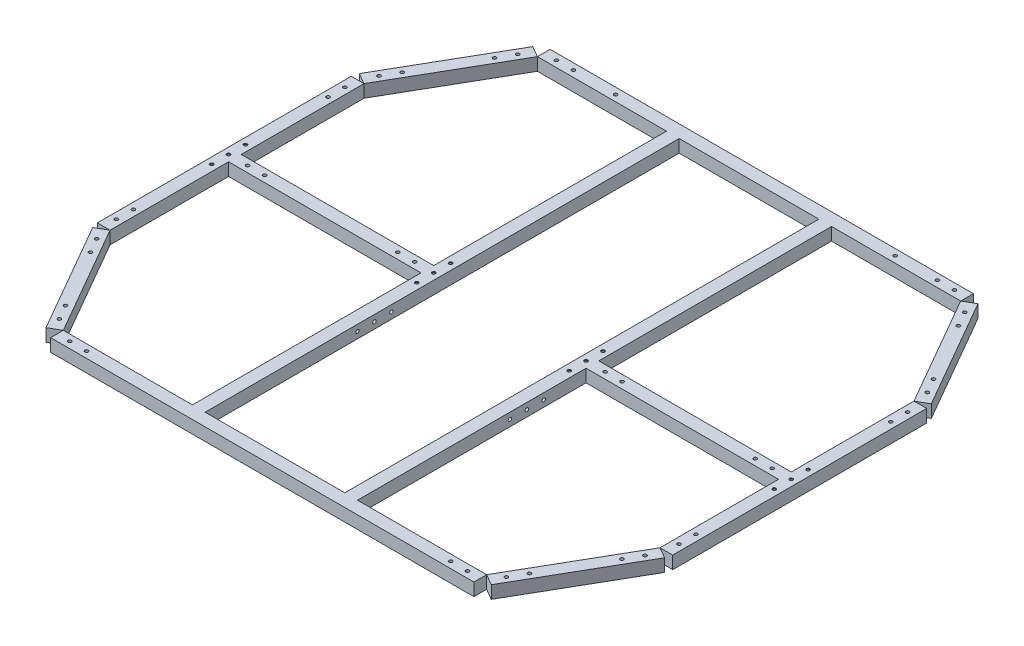
from build123d import *

# Parameters (mm, degrees)
SKETCH_1_R          = 2
EXTRUDE_1_DEPTH     = 15
SKETCH_1_W          = 165
SKETCH_1_H          = 560
EXTRUDE_1_2_DEPTH   = 15
SKETCH_1_W_2        = 15
SKETCH_1_H_2        = 300
EXTRUDE_1_3_DEPTH   = 15
EXTRUDE_1_4_DEPTH   = 15
EXTRUDE_1_5_DEPTH   = 15
EXTRUDE_1_6_DEPTH   = 15
EXTRUDE_1_7_DEPTH   = 15
SKETCH_2_R          = 2
CUT_EXTRUDE_1_DEPTH = 310
SKETCH_3_R          = 2
CUT_EXTRUDE_2_DEPTH = 333
SHELL_1_T           = -1
SHELL_2_T           = -1
SHELL_3_T           = -1
SHELL_4_T           = -1
MIRROR_START        = 1
MIRROR_1_OUTLINE_R  = 3
MIRROR_1_OUTLINE_W  = 13
MIRROR_1_OUTLINE_H  = 299
MIRROR_1_DEPTH      = 13
SKETCH_4_W          = 227.333147735
SKETCH_4_H          = 15
EXTRUDE_2_DEPTH     = 15
SKETCH_5_R          = 2
CUT_EXTRUDE_3_DEPTH = 15


# Read off the part's stored shape, not the designer's step: 镜向1
with BuildPart() as part:
    # 草图1 → 凸台-拉伸1 (new body)
    with BuildSketch(Plane(origin=(0, 0, 0), x_dir=(1, 0, 0), z_dir=(0, 1, 0))):
        Polygon((-263, 0.016685226), (-250, 7.5), (-324.833147735, 137.5), (-337.833147735, 130.016685226), align=None)
        with Locations(Location((-263.983314774, 16.758342613, 0), (0, 0, 270))):
            Circle(SKETCH_1_R, mode=Mode.SUBTRACT)
        with Locations(Location((-273.961067805, 34.091675947, 0), (0, 0, 270))):
            Circle(SKETCH_1_R, mode=Mode.SUBTRACT)
        with Locations(Location((-323.849832962, 120.758342613, 0), (0, 0, 270))):
            Circle(SKETCH_1_R, mode=Mode.SUBTRACT)
        with Locations(Location((-313.872079931, 103.42500928, 0), (0, 0, 270))):
            Circle(SKETCH_1_R, mode=Mode.SUBTRACT)
    extrude(amount=EXTRUDE_1_DEPTH)

    # 抽壳4
    shell_4_openings = [part.faces().sort_by_distance(p)[0] for p in [
        (-331.333147735, 7.5, -133.758342613),
    ]]
    offset(amount=SHELL_4_T, openings=shell_4_openings, kind=Kind.INTERSECTION)


with BuildPart() as body_2:
    # 草图1 → Extrude 1 2 (new body)
    with BuildSketch(Plane(origin=(0, 0, 0), x_dir=(1, 0, 0), z_dir=(0, 1, 0))):
        Polygon((250, 7.5), (97.5, 7.5), (97.5, 567.5), (250, 567.5), (250, 582.5), (-250, 582.5), (-250, 567.5), (-97.5, 567.5), (-97.5, 7.5), (-250, 7.5), (-250, -7.5), (250, -7.5), align=None)
        with Locations((0, 287.5)):
            Rectangle(SKETCH_1_W, SKETCH_1_H, mode=Mode.SUBTRACT)
        with Locations(Location((-235, 0, 0), (0, 0, 270))):
            Circle(SKETCH_1_R, mode=Mode.SUBTRACT)
        with Locations(Location((-215, 0, 0), (0, 0, 270))):
            Circle(SKETCH_1_R, mode=Mode.SUBTRACT)
        with Locations(Location((215, 0, 0), (0, 0, 270))):
            Circle(SKETCH_1_R, mode=Mode.SUBTRACT)
        with Locations(Location((235, 0, 0), (0, 0, 270))):
            Circle(SKETCH_1_R, mode=Mode.SUBTRACT)
        with Locations(Location((235, 575, 0), (0, 0, 270))):
            Circle(SKETCH_1_R, mode=Mode.SUBTRACT)
        with Locations(Location((-235, 575, 0), (0, 0, 270))):
            Circle(SKETCH_1_R, mode=Mode.SUBTRACT)
        with Locations(Location((-215, 575, 0), (0, 0, 270))):
            Circle(SKETCH_1_R, mode=Mode.SUBTRACT)
        with Locations(Location((215, 575, 0), (0, 0, 270))):
            Circle(SKETCH_1_R, mode=Mode.SUBTRACT)
    extrude(amount=EXTRUDE_1_2_DEPTH)

    # 草图2 → 切除-拉伸1 (cut)
    with BuildSketch(Plane(origin=(97.5, 0, 0), x_dir=(0, 0, -1), z_dir=(1, 0, 0))):
        with Locations(Location((227.5, 7.5, 0), (0, 0, 180))):
            Circle(SKETCH_2_R)
        with Locations(Location((207.5, 7.5, 0), (0, 0, 180))):
            Circle(SKETCH_2_R)
        with Locations(Location((187.5, 7.5, 0), (0, 0, 180))):
            Circle(SKETCH_2_R)
    extrude(amount=-CUT_EXTRUDE_1_DEPTH, mode=Mode.SUBTRACT)

    # 草图3 → 切除-拉伸2 (cut)
    with BuildSketch(Plane(origin=(0, 15, 0), x_dir=(1, 0, 0), z_dir=(0, 1, 0))):
        with Locations(Location((-165, 575, 0), (0, 0, 270))):
            Circle(SKETCH_3_R)
        with Locations(Location((165, 575, 0), (0, 0, 270))):
            Circle(SKETCH_3_R)
    extrude(amount=-CUT_EXTRUDE_2_DEPTH, mode=Mode.SUBTRACT)

    # 抽壳1
    shell_1_openings = [body_2.faces().sort_by_distance(p)[0] for p in [
        (-250, 7.5, -575),
    ]]
    offset(amount=SHELL_1_T, openings=shell_1_openings, kind=Kind.INTERSECTION)



with BuildPart() as body_3:
    # 草图1 → Extrude 1 3 (new body)
    with BuildSketch(Plane(origin=(0, 0, 0), x_dir=(1, 0, 0), z_dir=(0, 1, 0))):
        with Locations((-332.333147735, 287.5)):
            Rectangle(SKETCH_1_W_2, SKETCH_1_H_2)
        with Locations(Location((-332.333147735, 152.5, 0), (0, 0, 270))):
            Circle(SKETCH_1_R, mode=Mode.SUBTRACT)
        with Locations(Location((-332.333147735, 172.5, 0), (0, 0, 270))):
            Circle(SKETCH_1_R, mode=Mode.SUBTRACT)
        with Locations(Location((-332.333147735, 402.5, 0), (0, 0, 270))):
            Circle(SKETCH_1_R, mode=Mode.SUBTRACT)
        with Locations(Location((-332.333147735, 422.5, 0), (0, 0, 270))):
            Circle(SKETCH_1_R, mode=Mode.SUBTRACT)
    extrude(amount=EXTRUDE_1_3_DEPTH)

    # 抽壳3
    shell_3_openings = [body_3.faces().sort_by_distance(p)[0] for p in [
        (-332.333147735, 7.5, -437.5),
    ]]
    offset(amount=SHELL_3_T, openings=shell_3_openings, kind=Kind.INTERSECTION)


with BuildPart() as body_4:
    # 草图1 → Extrude 1 4 (new body)
    with BuildSketch(Plane(origin=(0, 0, 0), x_dir=(1, 0, 0), z_dir=(0, 1, 0))):
        Polygon((-337.833147735, 444.983314774), (-324.833147735, 437.5), (-250, 567.5), (-263, 574.983314774), align=None)
        with Locations(Location((-323.849832962, 454.241657387, 0), (0, 0, 270))):
            Circle(SKETCH_1_R, mode=Mode.SUBTRACT)
        with Locations(Location((-313.872079931, 471.57499072, 0), (0, 0, 270))):
            Circle(SKETCH_1_R, mode=Mode.SUBTRACT)
        with Locations(Location((-273.961067805, 540.908324053, 0), (0, 0, 270))):
            Circle(SKETCH_1_R, mode=Mode.SUBTRACT)
        with Locations(Location((-263.983314774, 558.241657387, 0), (0, 0, 270))):
            Circle(SKETCH_1_R, mode=Mode.SUBTRACT)
    extrude(amount=EXTRUDE_1_4_DEPTH)

    # 抽壳2
    shell_2_openings = [body_4.faces().sort_by_distance(p)[0] for p in [
        (-256.5, 7.5, -571.241657387),
    ]]
    offset(amount=SHELL_2_T, openings=shell_2_openings, kind=Kind.INTERSECTION)


with BuildPart() as body_5:
    # 草图1 → Extrude 1 5 (new body)
    with BuildSketch(Plane(origin=(0, 0, 0), x_dir=(1, 0, 0), z_dir=(0, 1, 0))):
        Polygon((324.833147735, 137.5), (250, 7.5), (263, 0.016685226), (337.833147735, 130.016685226), align=None)
        with Locations(Location((263.983314774, 16.758342613, 0), (0, 0, 270))):
            Circle(SKETCH_1_R, mode=Mode.SUBTRACT)
        with Locations(Location((273.961067805, 34.091675947, 0), (0, 0, 270))):
            Circle(SKETCH_1_R, mode=Mode.SUBTRACT)
        with Locations(Location((313.872079931, 103.42500928, 0), (0, 0, 270))):
            Circle(SKETCH_1_R, mode=Mode.SUBTRACT)
        with Locations(Location((323.849832962, 120.758342613, 0), (0, 0, 270))):
            Circle(SKETCH_1_R, mode=Mode.SUBTRACT)
    extrude(amount=EXTRUDE_1_5_DEPTH)


with BuildPart() as body_6:
    # 草图1 → Extrude 1 6 (new body)
    with BuildSketch(Plane(origin=(0, 0, 0), x_dir=(1, 0, 0), z_dir=(0, 1, 0))):
        with Locations((332.333147735, 287.5)):
            Rectangle(SKETCH_1_W_2, SKETCH_1_H_2)
        with Locations(Location((332.333147735, 152.5, 0), (0, 0, 270))):
            Circle(SKETCH_1_R, mode=Mode.SUBTRACT)
        with Locations(Location((332.333147735, 172.5, 0), (0, 0, 270))):
            Circle(SKETCH_1_R, mode=Mode.SUBTRACT)
        with Locations(Location((332.333147735, 402.5, 0), (0, 0, 270))):
            Circle(SKETCH_1_R, mode=Mode.SUBTRACT)
        with Locations(Location((332.333147735, 422.5, 0), (0, 0, 270))):
            Circle(SKETCH_1_R, mode=Mode.SUBTRACT)
    extrude(amount=EXTRUDE_1_6_DEPTH)


with BuildPart() as body_7:
    # 草图1 → Extrude 1 7 (new body)
    with BuildSketch(Plane(origin=(0, 0, 0), x_dir=(1, 0, 0), z_dir=(0, 1, 0))):
        Polygon((250, 567.5), (324.833147735, 437.5), (337.833147735, 444.983314774), (263, 574.983314774), align=None)
        with Locations(Location((313.872079931, 471.57499072, 0), (0, 0, 270))):
            Circle(SKETCH_1_R, mode=Mode.SUBTRACT)
        with Locations(Location((323.849832962, 454.241657387, 0), (0, 0, 270))):
            Circle(SKETCH_1_R, mode=Mode.SUBTRACT)
        with Locations(Location((273.961067805, 540.908324053, 0), (0, 0, 270))):
            Circle(SKETCH_1_R, mode=Mode.SUBTRACT)
        with Locations(Location((263.983314774, 558.241657387, 0), (0, 0, 270))):
            Circle(SKETCH_1_R, mode=Mode.SUBTRACT)
    extrude(amount=EXTRUDE_1_7_DEPTH)


with BuildPart() as mirror_1_tool:
    # 镜向1 outline → 镜向1 (new body)
    # profile 1 of 3: a face of its own
    with BuildSketch(Plane(origin=(0, 0, 0), x_dir=(1, 0, 0), z_dir=(0, 1, 0)).offset(MIRROR_START)):
        Polygon((262.133333333, 574.484427122), (250.866666667, 567.998887652), (325.200926751, 438.865554318), (336.467593417, 445.351093789), align=None)
        with Locations((263.983314774, 558.241657387)):
            Circle(MIRROR_1_OUTLINE_R, mode=Mode.SUBTRACT)
        with Locations((273.961067805, 540.908324053)):
            Circle(MIRROR_1_OUTLINE_R, mode=Mode.SUBTRACT)
        with Locations((313.872079931, 471.57499072)):
            Circle(MIRROR_1_OUTLINE_R, mode=Mode.SUBTRACT)
        with Locations((323.849832962, 454.241657387)):
            Circle(MIRROR_1_OUTLINE_R, mode=Mode.SUBTRACT)
    # profile 2 of 3: a face of its own
    with BuildSketch(Plane(origin=(0, 0, 0), x_dir=(1, 0, 0), z_dir=(0, 1, 0)).offset(MIRROR_START)):
        Polygon((262.632220985, 1.382239545), (336.966481069, 130.515572878), (325.699814402, 137.001112348), (251.365554318, 7.867779015), align=None)
        with Locations((263.983314774, 16.758342613)):
            Circle(MIRROR_1_OUTLINE_R, mode=Mode.SUBTRACT)
        with Locations((273.961067805, 34.091675947)):
            Circle(MIRROR_1_OUTLINE_R, mode=Mode.SUBTRACT)
        with Locations((313.872079931, 103.42500928)):
            Circle(MIRROR_1_OUTLINE_R, mode=Mode.SUBTRACT)
        with Locations((323.849832962, 120.758342613)):
            Circle(MIRROR_1_OUTLINE_R, mode=Mode.SUBTRACT)
    # profile 3 of 3: a face of its own
    with BuildSketch(Plane(origin=(0, 0, 0), x_dir=(1, 0, 0), z_dir=(0, 1, 0)).offset(MIRROR_START)):
        with Locations((332.333147735, 288)):
            Rectangle(MIRROR_1_OUTLINE_W, MIRROR_1_OUTLINE_H)
        with Locations((332.333147735, 152.5)):
            Circle(MIRROR_1_OUTLINE_R, mode=Mode.SUBTRACT)
        with Locations((332.333147735, 172.5)):
            Circle(MIRROR_1_OUTLINE_R, mode=Mode.SUBTRACT)
        with Locations((332.333147735, 402.5)):
            Circle(MIRROR_1_OUTLINE_R, mode=Mode.SUBTRACT)
        with Locations((332.333147735, 422.5)):
            Circle(MIRROR_1_OUTLINE_R, mode=Mode.SUBTRACT)
    extrude(amount=MIRROR_1_DEPTH)


with BuildPart() as body_5_1:
    add(body_5.part)

    # 镜向1: cut by mirror_1_tool
    add(mirror_1_tool.part, mode=Mode.SUBTRACT)


with BuildPart() as body_6_1:
    add(body_6.part)

    # 镜向1: cut by mirror_1_tool
    add(mirror_1_tool.part, mode=Mode.SUBTRACT)


with BuildPart() as body_7_1:
    add(body_7.part)

    # 镜向1: cut by mirror_1_tool
    add(mirror_1_tool.part, mode=Mode.SUBTRACT)


with BuildPart() as body_2_1:
    add(body_2.part)

    add(body_3.part)  # 凸台-拉伸2 merges body 3

    add(body_6_1.part)  # 凸台-拉伸2 merges body 6
    # 草图4 → 凸台-拉伸2 (add)
    with BuildSketch(Plane(origin=(0, 15, 0), x_dir=(1, 0, 0), z_dir=(0, 1, 0))):
        with Locations((-211.166573868, 285)):
            Rectangle(SKETCH_4_W, SKETCH_4_H)
        with Locations((211.166573868, 285)):
            Rectangle(SKETCH_4_W, SKETCH_4_H)
    extrude(amount=-EXTRUDE_2_DEPTH)

    # 草图5 → 切除-拉伸3 (cut)
    with BuildSketch(Plane(origin=(0, 15, 0), x_dir=(1, 0, 0), z_dir=(0, 1, 0))):
        with Locations(Location((-332.333147735, 285, 0), (0, 0, 270))):
            Circle(SKETCH_5_R)
        with Locations(Location((-332.333147735, 305, 0), (0, 0, 270))):
            Circle(SKETCH_5_R)
        with Locations(Location((-332.333147735, 265, 0), (0, 0, 270))):
            Circle(SKETCH_5_R)
        with Locations(Location((-309.833147735, 285, 0), (0, 0, 270))):
            Circle(SKETCH_5_R)
        with Locations(Location((-289.833147735, 285, 0), (0, 0, 270))):
            Circle(SKETCH_5_R)
        with Locations(Location((-132.5, 285, 0), (0, 0, 90))):
            Circle(SKETCH_5_R)
        with Locations(Location((-112.5, 285, 0), (0, 0, 90))):
            Circle(SKETCH_5_R)
        with Locations(Location((-90, 265, 0), (0, 0, 270))):
            Circle(SKETCH_5_R)
        with Locations(Location((-90, 305, 0), (0, 0, 270))):
            Circle(SKETCH_5_R)
        with Locations(Location((-90, 285, 0), (0, 0, 270))):
            Circle(SKETCH_5_R)
    cut_extrude_3 = extrude(amount=-CUT_EXTRUDE_3_DEPTH, mode=Mode.SUBTRACT)

    # 镜向2: 切除-拉伸3 across plane
    add(cut_extrude_3.mirror(Plane.ZY), mode=Mode.SUBTRACT)


solid = Compound([part.part, body_4.part, body_5_1.part, body_7_1.part, body_2_1.part])
